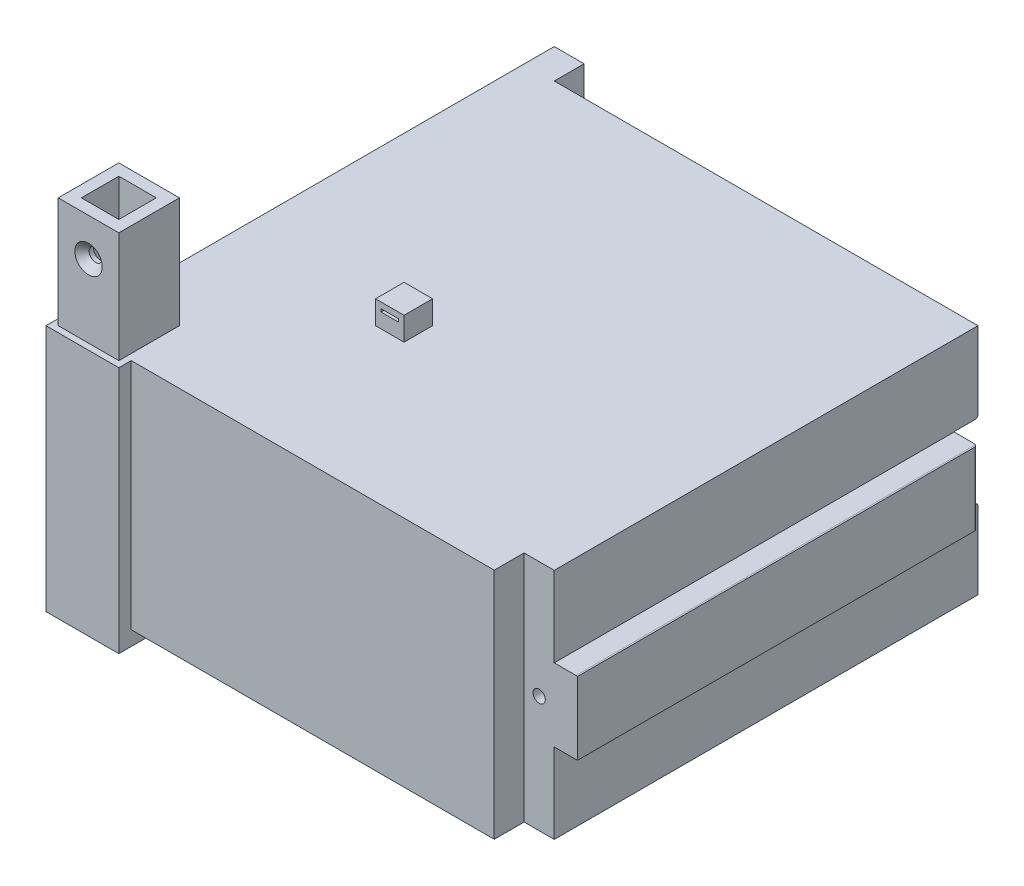
from build123d import *

# Parameters (mm, degrees)
SKETCH1_W                                           = 155.7
SKETCH1_H                                           = 155.7
BOSS_EXTRUDE2_DEPTH                                 = 80
SKETCH3_W                                           = 8
SKETCH3_H                                           = 25
BOSS_EXTRUDE4_DEPTH                                 = 145.45
CHAMFER1_SIZE                                       = 0.508
CHAMFER1_SIZE2                                      = 0.03552282
CHAMFER2_SIZE                                       = 0.508
CHAMFER2_SIZE2                                      = 0.03552282
SKETCH4_W                                           = 8.2
SKETCH4_H                                           = 25.2
CUT_EXTRUDE6_DEPTH                                  = 160.2
FILLET1_R                                           = 1
SKETCH6_W                                           = 10.35
SKETCH6_H                                           = 10.25
CUT_EXTRUDE7_DEPTH                                  = 80
SKETCH7_W                                           = 10.25
SKETCH7_H                                           = 10.25
BOSS_EXTRUDE5_DEPTH                                 = 80
CSK_FOR_M3_COUNTERSUNK_FLAT_HEAD_SCREW1_D           = 3.4
CSK_FOR_M3_COUNTERSUNK_FLAT_HEAD_SCREW1_DEPTH       = 16
CSK_FOR_M3_COUNTERSUNK_FLAT_HEAD_SCREW1_CSINK_D     = 6.3
CSK_FOR_M3_COUNTERSUNK_FLAT_HEAD_SCREW1_CSINK_ANGLE = 90
CSK_FOR_M3_COUNTERSUNK_FLAT_HEAD_SCREW1_TIP         = 1.021463052
SKETCH12_R                                          = 2.1
CUT_EXTRUDE9_DEPTH                                  = 5
FILLET2_START                                       = -18.821212121
FILLET2_DEPTH                                       = 152.821212121
FILLET3_START                                       = -18.821212121
FILLET3_DEPTH                                       = 152.821212121
SKETCH14_W                                          = 9.8
SKETCH14_H                                          = 9.8
BOSS_EXTRUDE6_DEPTH                                 = 8
CUT_EXTRUDE12_START                                 = -9.8
SKETCH17_W                                          = 6
SKETCH17_H                                          = 1
CUT_EXTRUDE12_DEPTH                                 = 1
CUT_EXTRUDE13_START                                 = -9.8
SKETCH19_W                                          = 6
SKETCH19_H                                          = 1
CUT_EXTRUDE13_DEPTH                                 = 1
BOSS_EXTRUDE7_DEPTH                                 = 5
BOSS_EXTRUDE7_DEPTH_BACK                            = 80
SKETCH20_W                                          = 25
SKETCH20_H                                          = 25
SKETCH21_W                                          = 20.8
SKETCH21_H                                          = 20.8
BOSS_EXTRUDE8_DEPTH                                 = 38
SKETCH23_W                                          = 12.85
SKETCH23_H                                          = 12.85
CUT_EXTRUDE14_DEPTH                                 = 38
CSK_FOR_M4_COUNTERSUNK_FLAT_HEAD_SCREW1_D           = 4.5
CSK_FOR_M4_COUNTERSUNK_FLAT_HEAD_SCREW1_DEPTH       = 26
CSK_FOR_M4_COUNTERSUNK_FLAT_HEAD_SCREW1_CSINK_D     = 9.4
CSK_FOR_M4_COUNTERSUNK_FLAT_HEAD_SCREW1_CSINK_ANGLE = 90
CSK_FOR_M4_COUNTERSUNK_FLAT_HEAD_SCREW1_TIP         = 1.351936393


with BuildPart() as part:
    # Sketch1 → Boss-Extrude2 (new body)
    with BuildSketch(Plane(origin=(0, 0, 0), x_dir=(1, 0, 0), z_dir=(0, 1, 0))):
        with Locations((55.528787879, -61.975)):
            Rectangle(SKETCH1_W, SKETCH1_H)
    extrude(amount=BOSS_EXTRUDE2_DEPTH)

    # Sketch3 → Boss-Extrude4 (add)
    with BuildSketch(Plane.XY.offset(-15.875)):
        with Locations((137.378787879, 40)):
            Rectangle(SKETCH3_W, SKETCH3_H)
    extrude(amount=BOSS_EXTRUDE4_DEPTH)

    # Chamfer1
    chamfer1_edges = [part.edges().sort_by_distance(p)[0] for p in [
        (141.378787879, 52.5, 56.85),
    ]]
    chamfer1_side = [part.faces().sort_by_distance(p)[0] for p in [
        (137.378787879, 52.5, 56.85),
    ]]
    chamfer(chamfer1_edges, length=CHAMFER1_SIZE, length2=CHAMFER1_SIZE2, reference=chamfer1_side[0])

    # Chamfer2
    chamfer2_edges = [part.edges().sort_by_distance(p)[0] for p in [
        (141.378787879, 27.5, 56.85),
    ]]
    chamfer2_side = [part.faces().sort_by_distance(p)[0] for p in [
        (137.378787879, 27.5, 56.85),
    ]]
    chamfer(chamfer2_edges, length=CHAMFER2_SIZE, length2=CHAMFER2_SIZE2, reference=chamfer2_side[0])

    # Sketch4 → Cut-Extrude6 (cut)
    with BuildSketch(Plane.ZY.offset(-141.378787879)):
        with Locations((-11.775, 40)):
            Rectangle(SKETCH4_W, SKETCH4_H)
    extrude(amount=CUT_EXTRUDE6_DEPTH, mode=Mode.SUBTRACT)

    # Fillet1
    fillet1_edges = [part.edges().sort_by_distance(p)[0] for p in [
        (141.378787879, 40, -7.675),
    ]]
    fillet(fillet1_edges, radius=FILLET1_R)

    # Sketch6 → Cut-Extrude7 (cut)
    with BuildSketch(Plane(origin=(0, 80, 0), x_dir=(1, 0, 0), z_dir=(0, 1, 0))):
        with Locations((128.203787879, -134.7)):
            Rectangle(SKETCH6_W, SKETCH6_H)
    extrude(amount=-CUT_EXTRUDE7_DEPTH, mode=Mode.SUBTRACT)

    # Sketch7 → Boss-Extrude5 (add)
    with BuildSketch(Plane(origin=(0, 80, 0), x_dir=(1, 0, 0), z_dir=(0, 1, 0))):
        with Locations((-17.196212121, 21)):
            Rectangle(SKETCH7_W, SKETCH7_H)
    extrude(amount=-BOSS_EXTRUDE5_DEPTH)

    # CSK for M3 Countersunk Flat Head Screw1
    with Locations(Plane.ZY.offset(22.321212121)):
        with Locations((-21, 40)):
            CounterSinkHole(CSK_FOR_M3_COUNTERSUNK_FLAT_HEAD_SCREW1_D / 2, CSK_FOR_M3_COUNTERSUNK_FLAT_HEAD_SCREW1_CSINK_D / 2, depth=CSK_FOR_M3_COUNTERSUNK_FLAT_HEAD_SCREW1_DEPTH, counter_sink_angle=CSK_FOR_M3_COUNTERSUNK_FLAT_HEAD_SCREW1_CSINK_ANGLE)
            with Locations((0, 0, -(CSK_FOR_M3_COUNTERSUNK_FLAT_HEAD_SCREW1_DEPTH + CSK_FOR_M3_COUNTERSUNK_FLAT_HEAD_SCREW1_TIP / 2))):  # 118° drill point
                Cone(0, CSK_FOR_M3_COUNTERSUNK_FLAT_HEAD_SCREW1_D / 2, CSK_FOR_M3_COUNTERSUNK_FLAT_HEAD_SCREW1_TIP, mode=Mode.SUBTRACT)

    # Sketch12 → Cut-Extrude9 (cut)
    with BuildSketch(Plane.XY.offset(129.575)):
        with Locations((128.203787879, 40)):
            Circle(SKETCH12_R)
    extrude(amount=-CUT_EXTRUDE9_DEPTH, mode=Mode.SUBTRACT)

    # Fillet2: read off the stored shape, not the designer's step
    # Fillet2 outline → Fillet2 (cut)
    with BuildSketch(Plane.YZ.offset(FILLET2_START)):
        with BuildLine():
            Line((52.6, -15.875), (53.6, -15.875))
            ThreePointArc((53.6, -15.875), (52.892893219, -15.582106781), (52.6, -14.875))
            Line((52.6, -14.875), (52.6, -15.875))
        make_face()
    extrude(amount=FILLET2_DEPTH, mode=Mode.SUBTRACT)

    # Fillet3: read off the stored shape, not the designer's step
    # Fillet3 outline → Fillet3 (cut)
    with BuildSketch(Plane.YZ.offset(FILLET3_START)):
        with BuildLine():
            ThreePointArc((27.4, -14.875), (27.107106781, -15.582106781), (26.4, -15.875))
            Line((26.4, -15.875), (27.4, -15.875))
            Line((27.4, -15.875), (27.4, -14.875))
        make_face()
    extrude(amount=FILLET3_DEPTH, mode=Mode.SUBTRACT)

    # Sketch14 → Boss-Extrude6 (add)
    with BuildSketch(Plane(origin=(0, 80, 0), x_dir=(1, 0, 0), z_dir=(0, 1, 0))):
        with Locations((34.878787879, -82.625)):
            Rectangle(SKETCH14_W, SKETCH14_H)
    extrude(amount=BOSS_EXTRUDE6_DEPTH)

    # Sketch17 → Cut-Extrude12 (cut)
    with BuildSketch(Plane(origin=(39.778787879, 0, 0), x_dir=(0, 0, -1), z_dir=(1, 0, 0)).offset(CUT_EXTRUDE12_START)):
        with Locations((-82.625, 85.5)):
            Rectangle(SKETCH17_W, SKETCH17_H)
    extrude(amount=CUT_EXTRUDE12_DEPTH, mode=Mode.SUBTRACT)

    # Sketch19 → Cut-Extrude13 (cut)
    with BuildSketch(Plane(origin=(0, 0, 77.725), x_dir=(-1, 0, 0), z_dir=(0, 0, -1)).offset(CUT_EXTRUDE13_START)):
        with Locations((-34.878787879, 85.5)):
            Rectangle(SKETCH19_W, SKETCH19_H)
    extrude(amount=CUT_EXTRUDE13_DEPTH, mode=Mode.SUBTRACT)

    # Sketch20 → Boss-Extrude7 (add, two sides: drawn at the far end of the back side and taken through both)
    with BuildSketch(Plane(origin=(0, 0, 0), x_dir=(-1, 0, 0), z_dir=(0, -1, 0)).offset(-BOSS_EXTRUDE7_DEPTH_BACK)):
        with Locations((14.071212121, -131.575)):
            Rectangle(SKETCH20_W, SKETCH20_H)
    extrude(amount=BOSS_EXTRUDE7_DEPTH + BOSS_EXTRUDE7_DEPTH_BACK)

    # Sketch21 → Boss-Extrude8 (add)
    with BuildSketch(Plane(origin=(0, 80, 0), x_dir=(1, 0, 0), z_dir=(0, 1, 0))):
        with Locations((-14.071212121, -131.575)):
            Rectangle(SKETCH21_W, SKETCH21_H)
    extrude(amount=BOSS_EXTRUDE8_DEPTH)

    # Sketch23 → Cut-Extrude14 (cut)
    with BuildSketch(Plane(origin=(0, 118, 0), x_dir=(1, 0, 0), z_dir=(0, 1, 0))):
        with Locations((-14.071212121, -131.575)):
            Rectangle(SKETCH23_W, SKETCH23_H)
    extrude(amount=-CUT_EXTRUDE14_DEPTH, mode=Mode.SUBTRACT)

    # CSK for M4 Countersunk Flat Head Screw1
    with Locations(Plane.XY.offset(141.975)):
        with Locations((-14.071212121, 105)):
            CounterSinkHole(CSK_FOR_M4_COUNTERSUNK_FLAT_HEAD_SCREW1_D / 2, CSK_FOR_M4_COUNTERSUNK_FLAT_HEAD_SCREW1_CSINK_D / 2, depth=CSK_FOR_M4_COUNTERSUNK_FLAT_HEAD_SCREW1_DEPTH, counter_sink_angle=CSK_FOR_M4_COUNTERSUNK_FLAT_HEAD_SCREW1_CSINK_ANGLE)
            with Locations((0, 0, -(CSK_FOR_M4_COUNTERSUNK_FLAT_HEAD_SCREW1_DEPTH + CSK_FOR_M4_COUNTERSUNK_FLAT_HEAD_SCREW1_TIP / 2))):  # 118° drill point
                Cone(0, CSK_FOR_M4_COUNTERSUNK_FLAT_HEAD_SCREW1_D / 2, CSK_FOR_M4_COUNTERSUNK_FLAT_HEAD_SCREW1_TIP, mode=Mode.SUBTRACT)


solid = part.part
